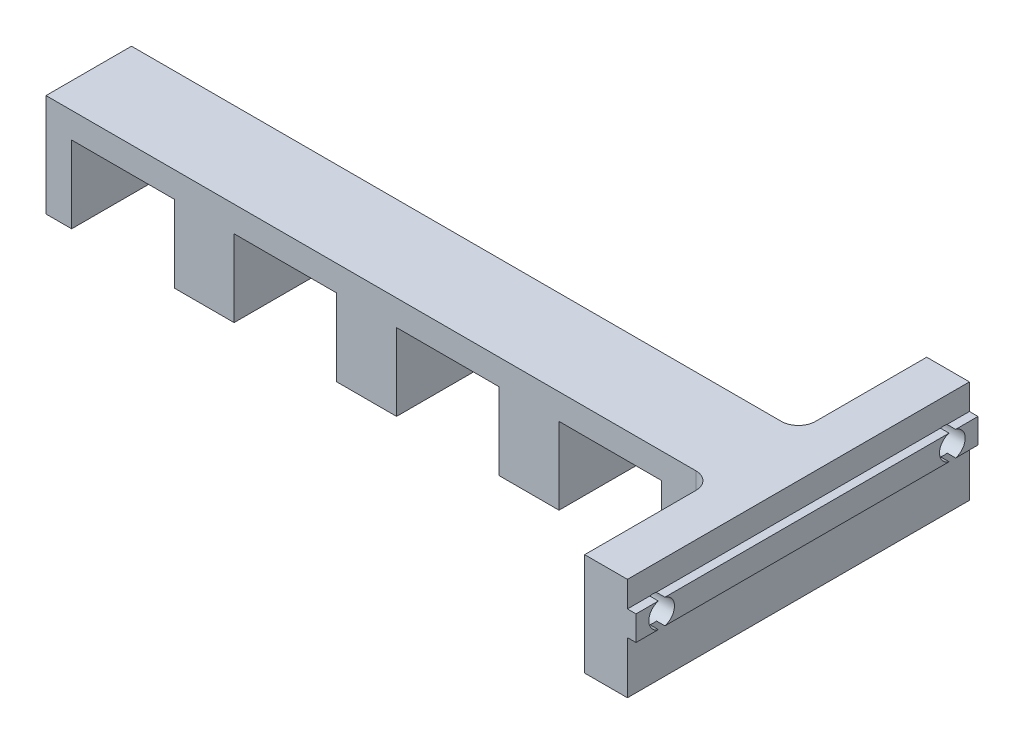
from build123d import *

# Parameters (mm, degrees)
MAIN_DEPTH             = 5
MAKERBEAMFIX_DEPTH     = 20
SKETCH2_R              = 1.5
MAKERBEAMFIXHOLE_DEPTH = 30
FILLET1_R              = 2


with BuildPart() as part:
    # Esquisse1 → Main (new, symmetric)
    with BuildSketch(Plane.XY):
        Polygon((3, 0), (3, 9), (15, 9), (15, 0), (22, 0), (22, 9), (34, 9), (34, 0), (41, 0), (41, 9), (53, 9), (53, 0), (60, 0), (60, 9), (72, 9), (72, 0), (83, 0), (83, 12), (0, 12), (0, 0), align=None)
    extrude(amount=MAIN_DEPTH, both=True)

    # Sketch1 → MakerBeamFix (add, symmetric)
    with BuildSketch(Plane.XY):
        Polygon((78, 12), (83, 12), (83, 9), (84, 9), (84, 6.1), (83, 6.1), (83, 0), (78, 0), align=None)
    extrude(amount=MAKERBEAMFIX_DEPTH, both=True)

    # Sketch2 → MakerBeamFixHole (cut)
    with BuildSketch(Plane(origin=(84, 0, 0), x_dir=(0, 0, -1), z_dir=(1, 0, 0))):
        with Locations((-17, 7.55)):
            Circle(SKETCH2_R)
        with Locations((17, 7.55)):
            Circle(SKETCH2_R)
    extrude(amount=-MAKERBEAMFIXHOLE_DEPTH, mode=Mode.SUBTRACT)

    # Fillet1
    fillet1_edges = [part.edges().sort_by_distance(p)[0] for p in [
        (78, 6, -5),
        (78, 6, 5),
    ]]
    fillet(fillet1_edges, radius=FILLET1_R)


solid = part.part
